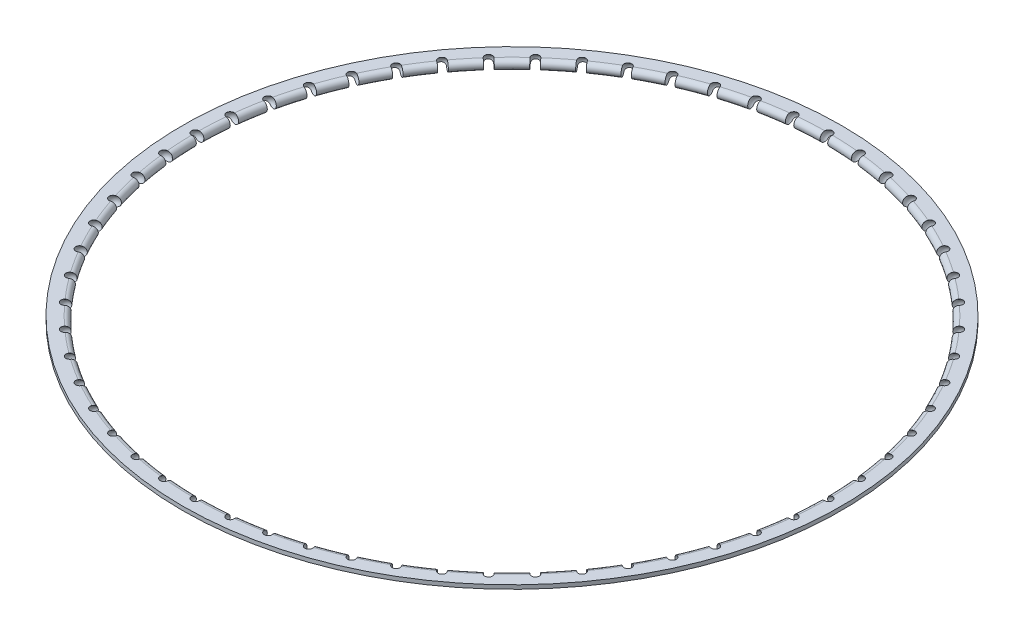
from build123d import *
from build123d.topology import SkipClean

# Parameters (mm, degrees)
CIRPATTERN2_COUNT = 60


with BuildPart() as part:
    # Sketch3 (on Front Plane) → Revolve4 (revolve)
    with BuildSketch(Plane.XY, mode=Mode.PRIVATE) as revolve4_sk:
        with BuildLine():
            Line((-121.774873734, -9.25), (-117, -9.25))
            ThreePointArc((-117, -9.25), (-115.383210818, -11.669696007), (-118.237436867, -12.237436867))
            Line((-118.237436867, -12.237436867), (-119.774873734, -10.7))
            Line((-119.774873734, -10.7), (-121.774873734, -10.7))
            Line((-121.774873734, -10.7), (-121.774873734, -9.25))
        make_face()
    revolve(revolve4_sk.sketch.rotate(Axis((0, 0, 0), (0, 1, 0)), 270), axis=Axis((0, 0, 0), (0, 1, 0)))

    # Sketch6 → Cut-Revolve2 (revolve, cut)
    with SkipClean():  # the faces are left unmerged after this step: merging them gives an invalid solid
        with BuildSketch(Plane.XY):
            with BuildLine():
                ThreePointArc((-114.75, -11), (-115.409009742, -9.409009742), (-117, -8.75))
                Line((-117, -8.75), (-117, -13.25))
                ThreePointArc((-117, -13.25), (-115.409009742, -12.590990258), (-114.75, -11))
            make_face()
            with BuildLine():
                Line((-117, -13.25), (-117, -8.75))
                ThreePointArc((-117, -8.75), (-119.25, -11), (-117, -13.25))
            make_face()
        cut_revolve2 = revolve(axis=Axis((-117, -8.75, 0), (0, -1, 0)), mode=Mode.SUBTRACT)

    # CirPattern2: Cut-Revolve2 ×60 about axis
    cirpattern2_axis = Axis((0, 0, 0), (0, 1, 0))
    for i in range(1, CIRPATTERN2_COUNT):
        add(cut_revolve2.rotate(cirpattern2_axis, i * 360 / CIRPATTERN2_COUNT), mode=Mode.SUBTRACT)


solid = part.part
